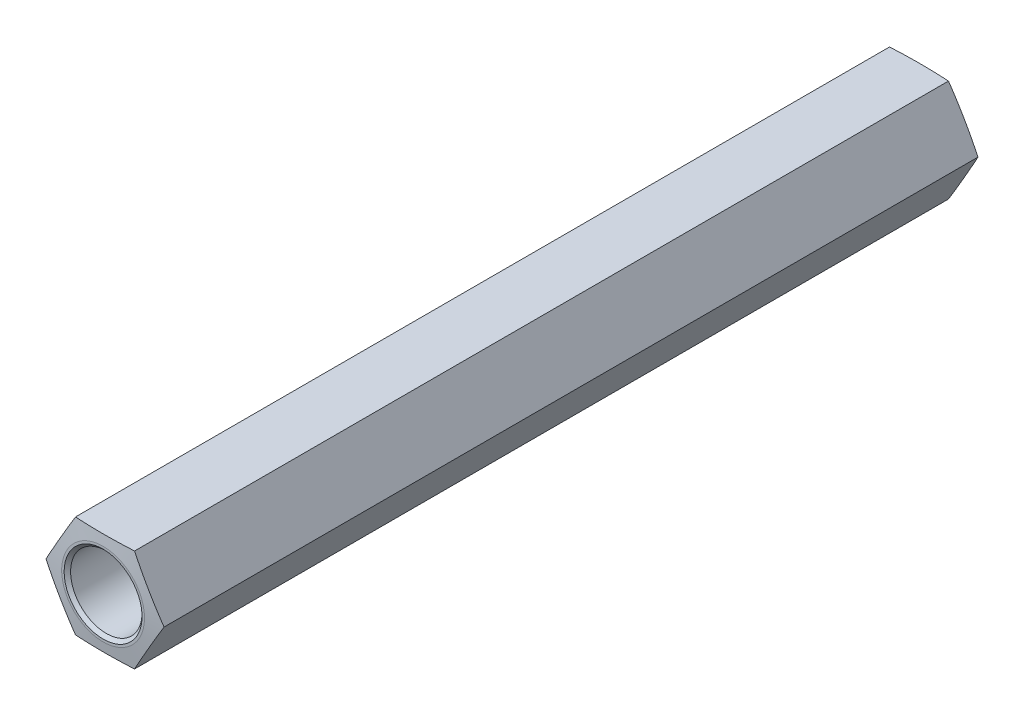
from build123d import *

# Parameters (mm, degrees)
SKETCH1_R      = 2.220000009
EXTRUDE1_DEPTH = 25.4
CHAMFER1_SIZE  = 0.2


with BuildPart() as part:
    # Sketch1 → Extrude1 (new, symmetric)
    with BuildSketch(Plane.XY):
        Polygon((-3.666174209, -6.3e-08), (-1.833087105, -3.175000063), (1.833087105, -3.174999937), (3.666174209, 6.3e-08), (1.833087105, 3.175000063), (-1.833087105, 3.174999937), align=None)
        with Locations((0, -6.3e-08)):
            Circle(SKETCH1_R, mode=Mode.SUBTRACT)
    extrude(amount=EXTRUDE1_DEPTH, both=True)

    # Chamfer1
    chamfer1_edges = [part.edges().sort_by_distance(p)[0] for p in [
        (-2.220000009, -6.3e-08, -25.4),
        (-2.220000009, -6.3e-08, 25.4),
    ]]
    chamfer(chamfer1_edges, length=CHAMFER1_SIZE)

    # Sketch2 → Cut-Revolve1 (revolve, cut)
    with BuildSketch(Plane.XZ):
        Polygon((-2.572739255, -25.4), (-3.666174209, -25.28), (-3.666174209, -25.4), align=None)
    cut_revolve1 = revolve(axis=Axis((0, -6.3e-08, 25.4), (0, 0, -1)), mode=Mode.SUBTRACT)

    # Mirror1: Cut-Revolve1 across plane
    add(cut_revolve1.mirror(Plane.XY), mode=Mode.SUBTRACT)


solid = part.part
